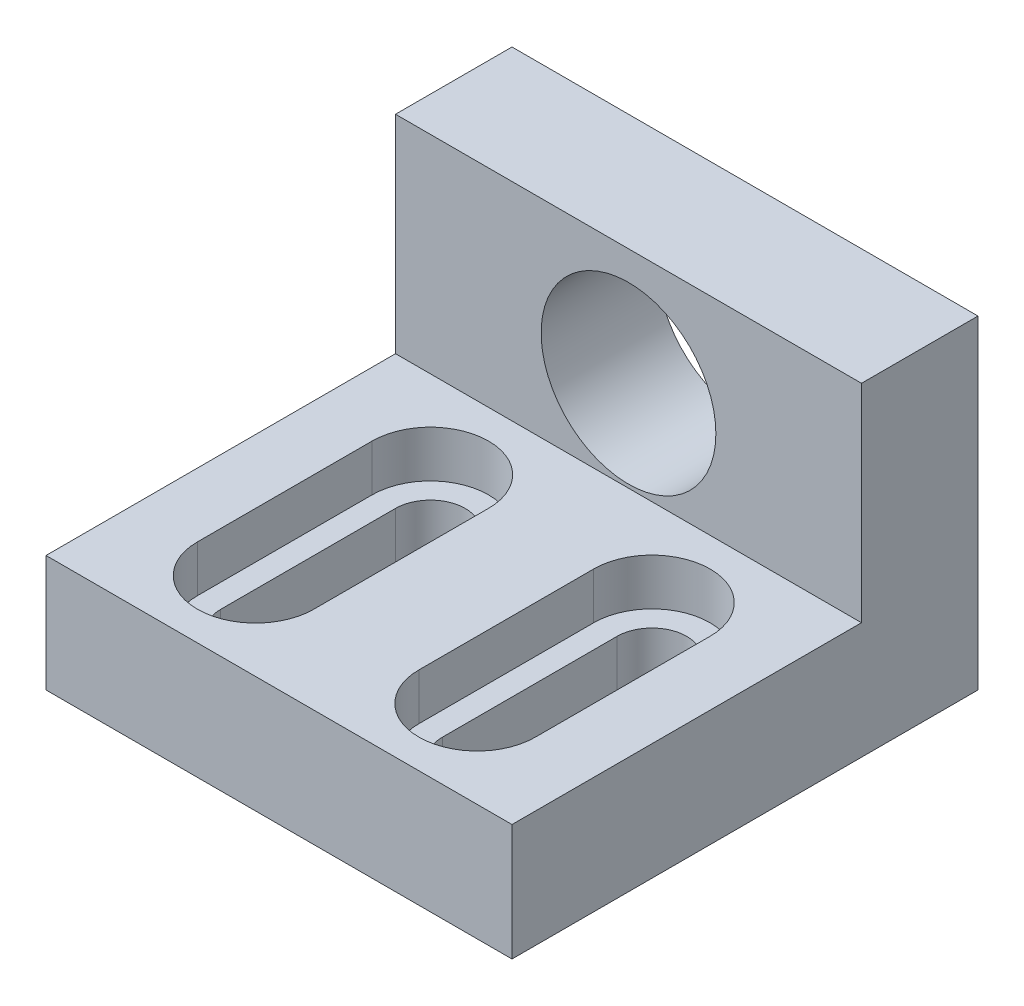
from build123d import *

# Parameters (mm, degrees)
SKETCH1_R           = 4.7625
BOSS_EXTRUDE1_DEPTH = 6.35
SKETCH2_W           = 25.4
SKETCH2_H           = 6.35
BOSS_EXTRUDE2_DEPTH = 19.05
CUT_EXTRUDE6_DEPTH  = 31.56481325
CUT_EXTRUDE7_DEPTH  = 2.54


with BuildPart() as part:
    # Sketch1 → Boss-Extrude1 (new body)
    with BuildSketch(Plane.XY):
        Polygon((-12.7, 0), (-12.7, -11.303), (12.7, -11.303), (12.7, 0), (12.7, 6.35), (-12.7, 6.35), align=None)
        Circle(SKETCH1_R, mode=Mode.SUBTRACT)
    extrude(amount=BOSS_EXTRUDE1_DEPTH)

    # Sketch2 → Boss-Extrude2 (add)
    with BuildSketch(Plane.XY.offset(6.35)):
        with Locations((0, -8.128)):
            Rectangle(SKETCH2_W, SKETCH2_H)
    extrude(amount=BOSS_EXTRUDE2_DEPTH)

    # Sketch8 → Cut-Extrude6 (cut, through all)
    with BuildSketch(Plane(origin=(0, -4.953, 0), x_dir=(1, 0, 0), z_dir=(0, 1, 0))):
        with BuildLine():
            ThreePointArc((-4.1402, -11.1125), (-6.03885, -9.21385), (-7.9375, -11.1125))
            Line((-7.9375, -11.1125), (-7.9375, -20.6375))
            ThreePointArc((-7.9375, -20.6375), (-6.03885, -22.53615), (-4.1402, -20.6375))
            Line((-4.1402, -20.6375), (-4.1402, -11.1125))
        make_face()
        with BuildLine():
            ThreePointArc((7.9375, -11.1125), (6.03885, -9.21385), (4.1402, -11.1125))
            Line((4.1402, -11.1125), (4.1402, -20.6375))
            ThreePointArc((4.1402, -20.6375), (6.03885, -22.53615), (7.9375, -20.6375))
            Line((7.9375, -20.6375), (7.9375, -11.1125))
        make_face()
    extrude(amount=-CUT_EXTRUDE6_DEPTH, mode=Mode.SUBTRACT)

    # Sketch8<10> → Cut-Extrude7 (cut)
    # profile 1 of 2: a face of its own
    with BuildSketch(Plane(origin=(0, -4.953, 0), x_dir=(1, 0, 0), z_dir=(0, 1, 0))):
        with BuildLine():
            Line((2.86385, -20.6375), (2.86385, -11.1125))
            ThreePointArc((2.86385, -11.1125), (6.03885, -7.9375), (9.21385, -11.1125))
            Line((9.21385, -11.1125), (9.21385, -20.6375))
            ThreePointArc((9.21385, -20.6375), (6.03885, -23.8125), (2.86385, -20.6375))
        make_face()
        with BuildLine():
            Line((4.1402, -11.1125), (4.1402, -20.6375))
            ThreePointArc((4.1402, -20.6375), (6.03885, -22.53615), (7.9375, -20.6375))
            Line((7.9375, -20.6375), (7.9375, -11.1125))
            ThreePointArc((7.9375, -11.1125), (6.03885, -9.21385), (4.1402, -11.1125))
        make_face(mode=Mode.SUBTRACT)
    # profile 2 of 2: a face of its own
    with BuildSketch(Plane(origin=(0, -4.953, 0), x_dir=(1, 0, 0), z_dir=(0, 1, 0))):
        with BuildLine():
            Line((-9.21385, -11.1125), (-9.21385, -20.6375))
            ThreePointArc((-9.21385, -20.6375), (-6.03885, -23.8125), (-2.86385, -20.6375))
            Line((-2.86385, -20.6375), (-2.86385, -11.1125))
            ThreePointArc((-2.86385, -11.1125), (-6.03885, -7.9375), (-9.21385, -11.1125))
        make_face()
        with BuildLine():
            Line((-7.9375, -11.1125), (-7.9375, -20.6375))
            ThreePointArc((-7.9375, -20.6375), (-6.03885, -22.53615), (-4.1402, -20.6375))
            Line((-4.1402, -20.6375), (-4.1402, -11.1125))
            ThreePointArc((-4.1402, -11.1125), (-6.03885, -9.21385), (-7.9375, -11.1125))
        make_face(mode=Mode.SUBTRACT)
    extrude(amount=-CUT_EXTRUDE7_DEPTH, mode=Mode.SUBTRACT)


solid = part.part
